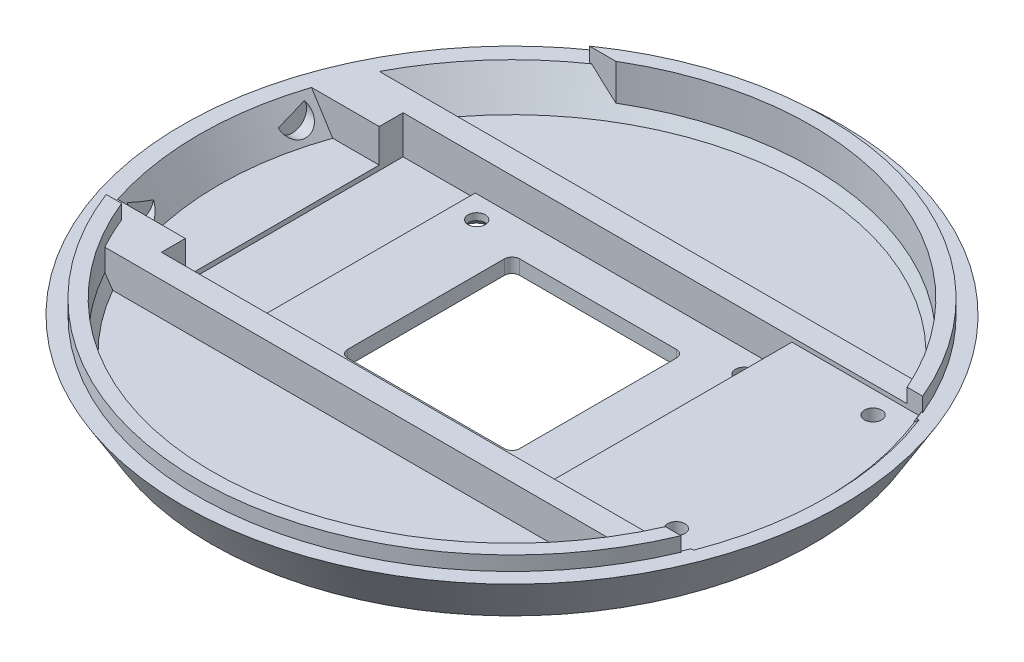
from build123d import *

# Parameters (mm, degrees)
SKETCH2_W                                           = 36
SKETCH2_H                                           = 36
CUT_EXTRUDE1_DEPTH                                  = 98.831487774
FILLET1_R                                           = 1.6
CSK_FOR_M3_COUNTERSUNK_FLAT_HEAD_SCREW2_D           = 3.6
CSK_FOR_M3_COUNTERSUNK_FLAT_HEAD_SCREW2_CSINK_D     = 6.7
CSK_FOR_M3_COUNTERSUNK_FLAT_HEAD_SCREW2_CSINK_ANGLE = 90
SKETCH19_W                                          = 15.1
SKETCH19_H                                          = 50.6
CUT_EXTRUDE4_DEPTH                                  = 1
BOSS_EXTRUDE1_REACH                                 = 133.392
BOSS_EXTRUDE1_START                                 = 33.3
SKETCH21_W                                          = 50.6
SKETCH21_H                                          = 6.1
BOSS_EXTRUDE2_REACH                                 = 100.092
SKETCH22_W                                          = 5
SKETCH22_H                                          = 7
BOSS_EXTRUDE2_DIRECTION_2_REACH                     = 100.092
BOSS_EXTRUDE3_REACH                                 = 148.192
BOSS_EXTRUDE3_START                                 = -48.1
SKETCH23_W                                          = 5.000000298
SKETCH23_H                                          = 7
SKETCH23_W_2                                        = 4.999999702
BOSS_EXTRUDE4_DEPTH                                 = 3
BOSS_EXTRUDE4_DIRECTION_2_REACH                     = 100.092
CUT_EXTRUDE5_DEPTH                                  = 0.9
CHAMFER1_SIZE                                       = 0.9
CUT_EXTRUDE6_START                                  = -58
SKETCH26_R                                          = 3
CUT_EXTRUDE6_DEPTH                                  = 4
CSK_FOR_M3_COUNTERSUNK_FLAT_HEAD_SCREW3_D           = 3.6
CSK_FOR_M3_COUNTERSUNK_FLAT_HEAD_SCREW3_CSINK_D     = 6.7
CSK_FOR_M3_COUNTERSUNK_FLAT_HEAD_SCREW3_CSINK_ANGLE = 90


with BuildPart() as part:
    # Sketch1 → Revolve1 (revolve)
    with BuildSketch(Plane.XY, mode=Mode.PRIVATE) as revolve1_sk:
        Polygon((0, 0), (63, 0), (69, 10), (65.501428863, 10), (61.301428863, 3), (0, 3), align=None)
    revolve(revolve1_sk.sketch.rotate(Axis((0, 0, 0), (0, 1, 0)), 90), axis=Axis((0, 0, 0), (0, 1, 0)))

    # Sketch2 → Cut-Extrude1 (cut, through all)
    with BuildSketch(Plane(origin=(0, 3, 0), x_dir=(1, 0, 0), z_dir=(0, 1, 0))):
        Rectangle(SKETCH2_W, SKETCH2_H)
    extrude(amount=-CUT_EXTRUDE1_DEPTH, mode=Mode.SUBTRACT)

    # Fillet1
    fillet1_edges = [part.edges().sort_by_distance(p)[0] for p in [
        (18, 1.5, -18),
        (18, 1.5, 18),
        (-18, 1.5, 18),
        (-18, 1.5, -18),
    ]]
    fillet(fillet1_edges, radius=FILLET1_R)

    # CSK for M3 Countersunk Flat Head Screw2 (through all)
    with Locations(Plane(origin=(-28, 0, -20.6), x_dir=(0, 0, -1), z_dir=(0, -1, 0))):
        with Locations((0, 0), (-41.2, 0), (-41.2, 56), (0, 56)):
            CounterSinkHole(CSK_FOR_M3_COUNTERSUNK_FLAT_HEAD_SCREW2_D / 2, CSK_FOR_M3_COUNTERSUNK_FLAT_HEAD_SCREW2_CSINK_D / 2, counter_sink_angle=CSK_FOR_M3_COUNTERSUNK_FLAT_HEAD_SCREW2_CSINK_ANGLE)

    # Sketch19 → Cut-Extrude4 (cut)
    with BuildSketch(Plane(origin=(0, 3, 0), x_dir=(1, 0, 0), z_dir=(0, 1, 0))):
        with Locations((-40.55, 0)):
            Rectangle(SKETCH19_W, SKETCH19_H)
    extrude(amount=-CUT_EXTRUDE4_DEPTH, mode=Mode.SUBTRACT)

    # Boss-Extrude1: up to this cone (the profile starts inside it)
    boss_extrude1_end = Plane(origin=(0, 6.05, 0), z_dir=(0, 1, 0)).offset(-105.219047105) * Cone(1e-06, 181.345486181, 302.242475968, align=(Align.CENTER, Align.CENTER, Align.MIN), mode=Mode.PRIVATE)
    # Sketch21 → Boss-Extrude1 (add, up to the surface)
    with BuildSketch(Plane(origin=(0, 0, 0), x_dir=(0, 0, -1), z_dir=(1, 0, 0)).offset(BOSS_EXTRUDE1_START), mode=Mode.PRIVATE) as boss_extrude1_sk1:
        with Locations((0, 6.05)):
            Rectangle(SKETCH21_W, SKETCH21_H)
    boss_extrude1_tool1 = extrude(boss_extrude1_sk1.sketch, amount=BOSS_EXTRUDE1_REACH, mode=Mode.PRIVATE) & boss_extrude1_end
    add(boss_extrude1_tool1.solids().sort_by_distance((33.3, 6.05, 0))[0])

    # Boss-Extrude2: up to this cone (the profile starts inside it)
    boss_extrude2_end = Plane(origin=(0, 6.5, 0), z_dir=(0, 1, 0)).offset(-105.669047105) * Cone(1e-06, 161.797486181, 269.662475968, align=(Align.CENTER, Align.CENTER, Align.MIN), mode=Mode.PRIVATE)
    # Sketch22 → Boss-Extrude2 (add, up to the surface)
    with BuildSketch(Plane(origin=(0, 0, 0), x_dir=(0, 0, -1), z_dir=(1, 0, 0)), mode=Mode.PRIVATE) as boss_extrude2_sk1:
        with Locations((-27.8, 6.5)):
            Rectangle(SKETCH22_W, SKETCH22_H)
    boss_extrude2_tool1 = extrude(boss_extrude2_sk1.sketch, amount=BOSS_EXTRUDE2_REACH, mode=Mode.PRIVATE) & boss_extrude2_end
    add(boss_extrude2_tool1.solids().sort_by_distance((0, 6.5, 27.8))[0])
    # Sketch22 → Boss-Extrude2 (add, up to the surface)
    with BuildSketch(Plane(origin=(0, 0, 0), x_dir=(0, 0, -1), z_dir=(1, 0, 0)), mode=Mode.PRIVATE) as boss_extrude2_sk2:
        with Locations((27.8, 6.5)):
            Rectangle(SKETCH22_W, SKETCH22_H)
    boss_extrude2_tool2 = extrude(boss_extrude2_sk2.sketch, amount=BOSS_EXTRUDE2_REACH, mode=Mode.PRIVATE) & boss_extrude2_end
    add(boss_extrude2_tool2.solids().sort_by_distance((0, 6.5, -27.8))[0])

    # Boss-Extrude2 direction 2: up to this cone (the profile starts inside it)
    boss_extrude2_direction_2_end = Plane(origin=(0, 6.5, 0), z_dir=(0, 1, 0)).offset(-105.669047105) * Cone(1e-06, 161.797486181, 269.662475968, align=(Align.CENTER, Align.CENTER, Align.MIN), mode=Mode.PRIVATE)
    # Sketch22 → Boss-Extrude2 direction 2 (add, up to the surface)
    with BuildSketch(Plane(origin=(0, 0, 0), x_dir=(0, 0, -1), z_dir=(1, 0, 0)), mode=Mode.PRIVATE) as boss_extrude2_direction_2_sk1:
        with Locations((-27.8, 6.5)):
            Rectangle(SKETCH22_W, SKETCH22_H)
    boss_extrude2_direction_2_tool1 = extrude(boss_extrude2_direction_2_sk1.sketch, amount=-BOSS_EXTRUDE2_DIRECTION_2_REACH, mode=Mode.PRIVATE) & boss_extrude2_direction_2_end
    add(boss_extrude2_direction_2_tool1.solids().sort_by_distance((0, 6.5, 27.8))[0])
    # Sketch22 → Boss-Extrude2 direction 2 (add, up to the surface)
    with BuildSketch(Plane(origin=(0, 0, 0), x_dir=(0, 0, -1), z_dir=(1, 0, 0)), mode=Mode.PRIVATE) as boss_extrude2_direction_2_sk2:
        with Locations((27.8, 6.5)):
            Rectangle(SKETCH22_W, SKETCH22_H)
    boss_extrude2_direction_2_tool2 = extrude(boss_extrude2_direction_2_sk2.sketch, amount=-BOSS_EXTRUDE2_DIRECTION_2_REACH, mode=Mode.PRIVATE) & boss_extrude2_direction_2_end
    add(boss_extrude2_direction_2_tool2.solids().sort_by_distance((0, 6.5, -27.8))[0])

    # Boss-Extrude3: up to this cone (the profile starts inside it)
    boss_extrude3_end = Plane(origin=(0, 6.5, 0), z_dir=(0, 1, 0)).offset(-105.669047105) * Cone(1e-06, 190.657486181, 317.762475968, align=(Align.CENTER, Align.CENTER, Align.MIN), mode=Mode.PRIVATE)
    # Sketch23 → Boss-Extrude3 (add, up to the surface)
    with BuildSketch(Plane(origin=(0, 0, 0), x_dir=(0, 0, -1), z_dir=(1, 0, 0)).offset(BOSS_EXTRUDE3_START), mode=Mode.PRIVATE) as boss_extrude3_sk1:
        with Locations((22.799999851, 6.5)):
            Rectangle(SKETCH23_W, SKETCH23_H)
    boss_extrude3_tool1 = extrude(boss_extrude3_sk1.sketch, amount=-BOSS_EXTRUDE3_REACH, mode=Mode.PRIVATE) & boss_extrude3_end
    add(boss_extrude3_tool1.solids().sort_by_distance((-48.1, 6.5, -22.8))[0])
    # Sketch23 → Boss-Extrude3 (add, up to the surface)
    with BuildSketch(Plane(origin=(0, 0, 0), x_dir=(0, 0, -1), z_dir=(1, 0, 0)).offset(BOSS_EXTRUDE3_START), mode=Mode.PRIVATE) as boss_extrude3_sk2:
        with Locations((-22.800000149, 6.5)):
            Rectangle(SKETCH23_W_2, SKETCH23_H)
    boss_extrude3_tool2 = extrude(boss_extrude3_sk2.sketch, amount=-BOSS_EXTRUDE3_REACH, mode=Mode.PRIVATE) & boss_extrude3_end
    add(boss_extrude3_tool2.solids().sort_by_distance((-48.1, 6.5, 22.8))[0])

    # Sketch24 → Boss-Extrude4 (add)
    with BuildSketch(Plane(origin=(0, 10, 0), x_dir=(1, 0, 0), z_dir=(0, 1, 0))):
        with BuildLine():
            Line((-32.130242763, 53.9), (-37.654382215, 53.9))
            ThreePointArc((-37.654382215, 53.9), (18.360858202, 63.134312272), (60.687498713, 25.3))
            Line((60.687498713, 25.3), (57.423623188, 25.3))
            ThreePointArc((57.423623188, 25.3), (19.090017636, 59.775695117), (-32.130242763, 53.9))
        make_face()
        with BuildLine():
            Line((57.423623188, -25.3), (60.687498713, -25.3))
            ThreePointArc((60.687498713, -25.3), (-0.915678776, -65.743623511), (-61.368579094, -23.6))
            Line((-61.368579094, -23.6), (-58.142948842, -23.6))
            ThreePointArc((-58.142948842, -23.6), (-0.922961185, -62.743211925), (57.423623188, -25.3))
        make_face()
    extrude(amount=BOSS_EXTRUDE4_DEPTH)

    # Sketch24 → Boss-Extrude4 direction 2 (add, up to next)
    with BuildSketch(Plane(origin=(0, 10, 0), x_dir=(1, 0, 0), z_dir=(0, 1, 0)), mode=Mode.PRIVATE) as boss_extrude4_direction_2_sk1:
        with BuildLine():
            Line((-32.130242763, 53.9), (-37.654382215, 53.9))
            ThreePointArc((-37.654382215, 53.9), (18.360858202, 63.134312272), (60.687498713, 25.3))
            Line((60.687498713, 25.3), (57.423623188, 25.3))
            ThreePointArc((57.423623188, 25.3), (19.090017636, 59.775695117), (-32.130242763, 53.9))
        make_face()
    boss_extrude4_direction_2_tool1 = extrude(boss_extrude4_direction_2_sk1.sketch, amount=-BOSS_EXTRUDE4_DIRECTION_2_REACH, mode=Mode.PRIVATE) - part.part
    # Sketch24 → Boss-Extrude4 direction 2 (add, up to next)
    with BuildSketch(Plane(origin=(0, 10, 0), x_dir=(1, 0, 0), z_dir=(0, 1, 0)), mode=Mode.PRIVATE) as boss_extrude4_direction_2_sk2:
        with BuildLine():
            Line((57.423623188, -25.3), (60.687498713, -25.3))
            ThreePointArc((60.687498713, -25.3), (-0.915678776, -65.743623511), (-61.368579094, -23.6))
            Line((-61.368579094, -23.6), (-58.142948842, -23.6))
            ThreePointArc((-58.142948842, -23.6), (-0.922961185, -62.743211925), (57.423623188, -25.3))
        make_face()
    boss_extrude4_direction_2_tool2 = extrude(boss_extrude4_direction_2_sk2.sketch, amount=-BOSS_EXTRUDE4_DIRECTION_2_REACH, mode=Mode.PRIVATE) - part.part
    add(boss_extrude4_direction_2_tool1.solids().sort_by_distance((-34.892312, 10, -54.963359))[0])
    add(boss_extrude4_direction_2_tool2.solids().sort_by_distance((-0.941954, 10, 64.034363))[0])

    # Sketch25 → Cut-Extrude5 (cut)
    with BuildSketch(Plane(origin=(0, 10, 0), x_dir=(1, 0, 0), z_dir=(0, 1, 0))):
        with BuildLine():
            Line((61.63635291, 23.6), (60, 23.6))
            Line((60, 23.6), (60, -23.6))
            Line((60, -23.6), (61.63635291, -23.6))
            ThreePointArc((61.63635291, -23.6), (66, 0), (61.63635291, 23.6))
        make_face()
    extrude(amount=-CUT_EXTRUDE5_DEPTH, mode=Mode.SUBTRACT)

    # Chamfer1
    chamfer1_edges = [part.edges().sort_by_distance(p)[0] for p in [
        (66, 9.1, 0),
    ]]
    chamfer(chamfer1_edges, length=CHAMFER1_SIZE - 0.0001)  # a hair under: the kernel refuses the full size

    # Sketch26 → Cut-Extrude6 (cut)
    with BuildSketch(Plane(origin=(0, 0, 0), x_dir=(0, 0, -1), z_dir=(1, 0, 0)).offset(CUT_EXTRUDE6_START)):
        with Locations((-16.000000298, 6.999998987)):
            Circle(SKETCH26_R)
        with Locations((15.999999702, 6.99999994)):
            Circle(SKETCH26_R)
    extrude(amount=-CUT_EXTRUDE6_DEPTH, mode=Mode.SUBTRACT)

    # CSK for M3 Countersunk Flat Head Screw3 (through all)
    with Locations(Plane(origin=(0, 0, 0), x_dir=(-1, 0, 0), z_dir=(0, -1, 0))):
        with Locations((-55, 20.6), (-55, -20.6)):
            CounterSinkHole(CSK_FOR_M3_COUNTERSUNK_FLAT_HEAD_SCREW3_D / 2, CSK_FOR_M3_COUNTERSUNK_FLAT_HEAD_SCREW3_CSINK_D / 2, counter_sink_angle=CSK_FOR_M3_COUNTERSUNK_FLAT_HEAD_SCREW3_CSINK_ANGLE)


solid = part.part
